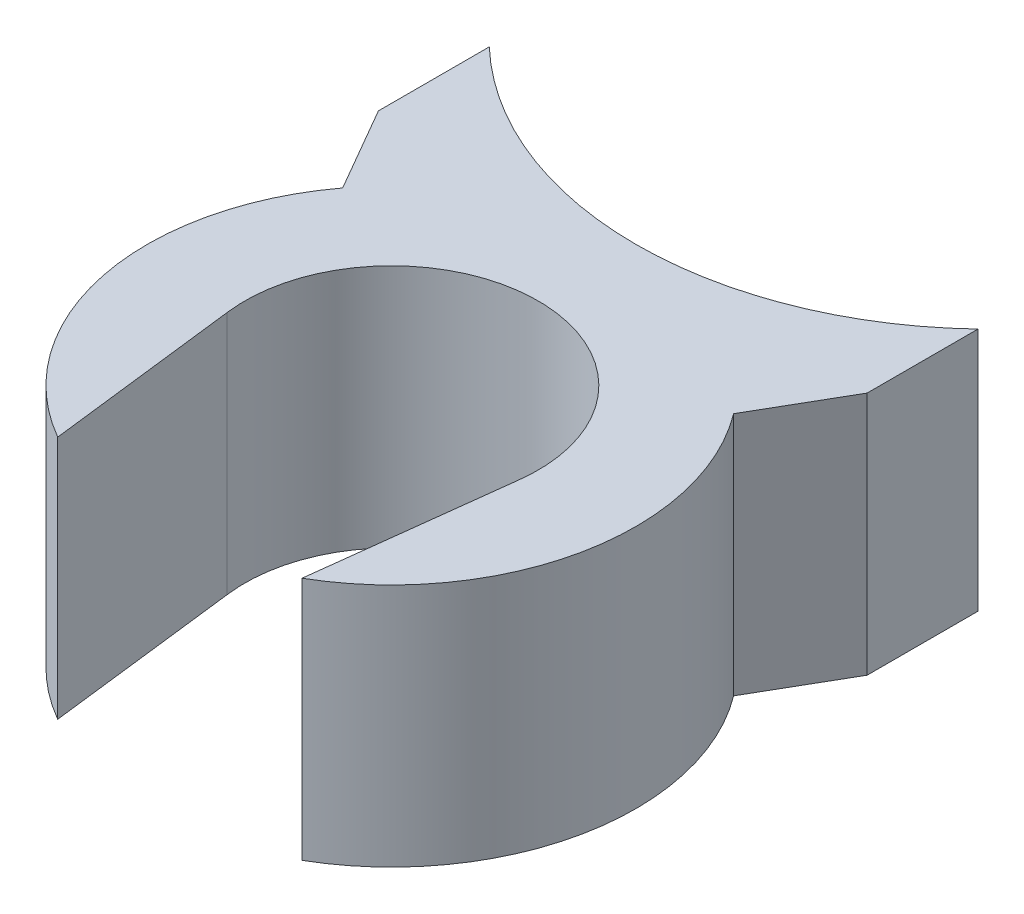
from build123d import *

# Parameters (mm, degrees)
CROQUIS1_R              = 3
SALIENTE_EXTRUIR1_DEPTH = 5
CORTAR_EXTRUIR1_START   = -10
CORTAR_EXTRUIR1_DEPTH   = 10
CORTAR_EXTRUIR2_DEPTH   = 10


with BuildPart() as part:
    # Croquis1 → Saliente-Extruir1 (new body)
    with BuildSketch(Plane(origin=(0, 0, 0), x_dir=(1, 0, 0), z_dir=(0, 1, 0))):
        with BuildLine():
            Line((-5, 7), (-5, 3))
            Line((-5, 3), (-4, 3))
            ThreePointArc((-4, 3), (0, -5), (4, 3))
            Line((4, 3), (5, 3))
            Line((5, 3), (5, 7))
            ThreePointArc((5, 7), (0, 5), (-5, 7))
        make_face()
        Circle(CROQUIS1_R, mode=Mode.SUBTRACT)
    extrude(amount=SALIENTE_EXTRUIR1_DEPTH)

    # Croquis2 → Cortar-Extruir1 (cut)
    with BuildSketch(Plane(origin=(0, 5, 0), x_dir=(1, 0, 0), z_dir=(0, 1, 0)).offset(CORTAR_EXTRUIR1_START)):
        with BuildLine():
            ThreePointArc((-2.5, -4.330127019), (-1.294095226, -4.829629131), (0, -5))
            ThreePointArc((0, -5), (1.294095226, -4.829629131), (2.5, -4.330127019))
            Line((2.5, -4.330127019), (2.981780701, -0.330127019))
            ThreePointArc((2.981780701, -0.330127019), (2.995441712, -0.165314693), (3, 0))
            ThreePointArc((3, 0), (-0.165314693, 2.995441712), (-2.981780701, -0.330127019))
            Line((-2.981780701, -0.330127019), (-2.5, -4.330127019))
        make_face()
    extrude(amount=CORTAR_EXTRUIR1_DEPTH, mode=Mode.SUBTRACT)

    # Croquis3 → Cortar-Extruir2 (cut)
    with BuildSketch(Plane(origin=(0, 5, 0), x_dir=(1, 0, 0), z_dir=(0, 1, 0))):
        Polygon((4, 3), (5, 4.732050808), (5, 3), align=None)
        Polygon((-4, 3), (-5, 4.732050808), (-5, 3), align=None)
    extrude(amount=-CORTAR_EXTRUIR2_DEPTH, mode=Mode.SUBTRACT)


solid = part.part
